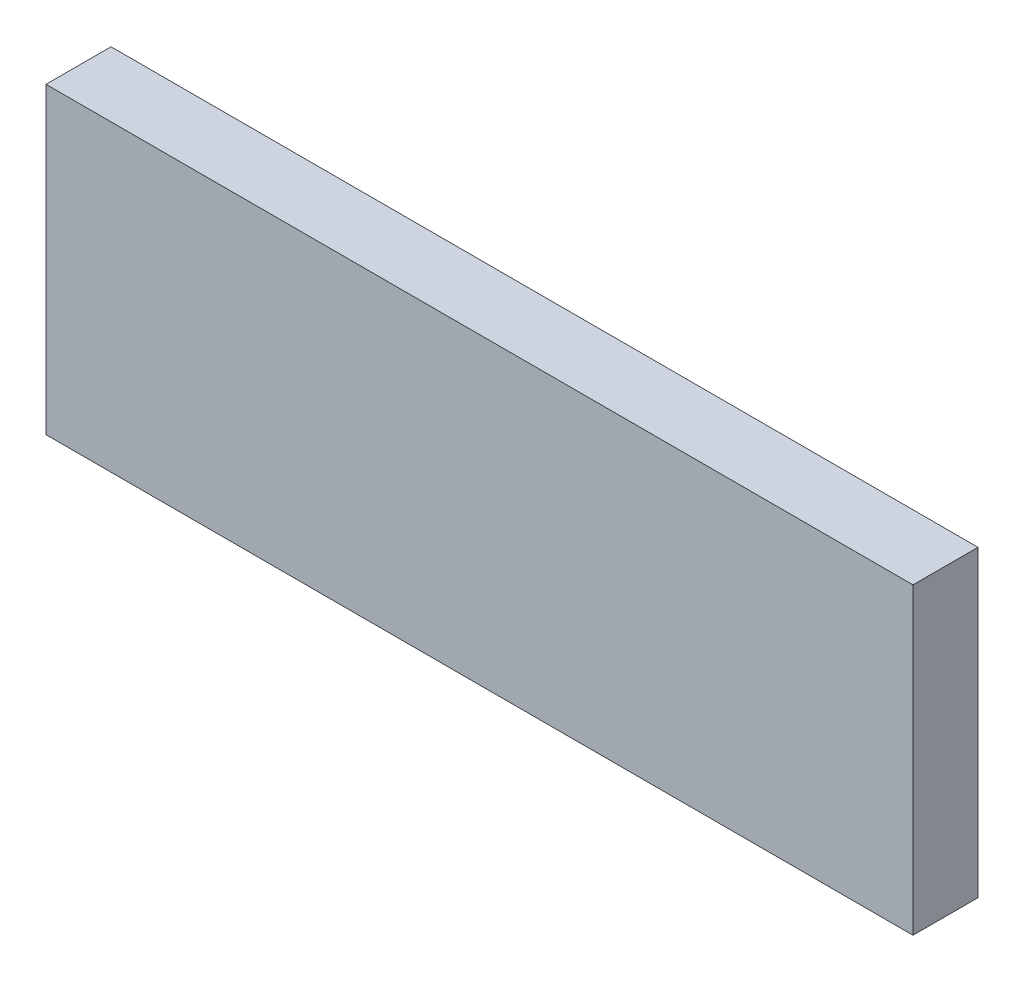
from build123d import *

# Parameters (mm, degrees)
CROQUIS1_W              = 80
CROQUIS1_H              = 28
SALIENTE_EXTRUIR1_DEPTH = 6


with BuildPart() as part:
    # Croquis1 → Saliente-Extruir1 (new body)
    with BuildSketch(Plane.XY):
        with Locations((40, 14)):
            Rectangle(CROQUIS1_W, CROQUIS1_H)
    extrude(amount=SALIENTE_EXTRUIR1_DEPTH)


solid = part.part
